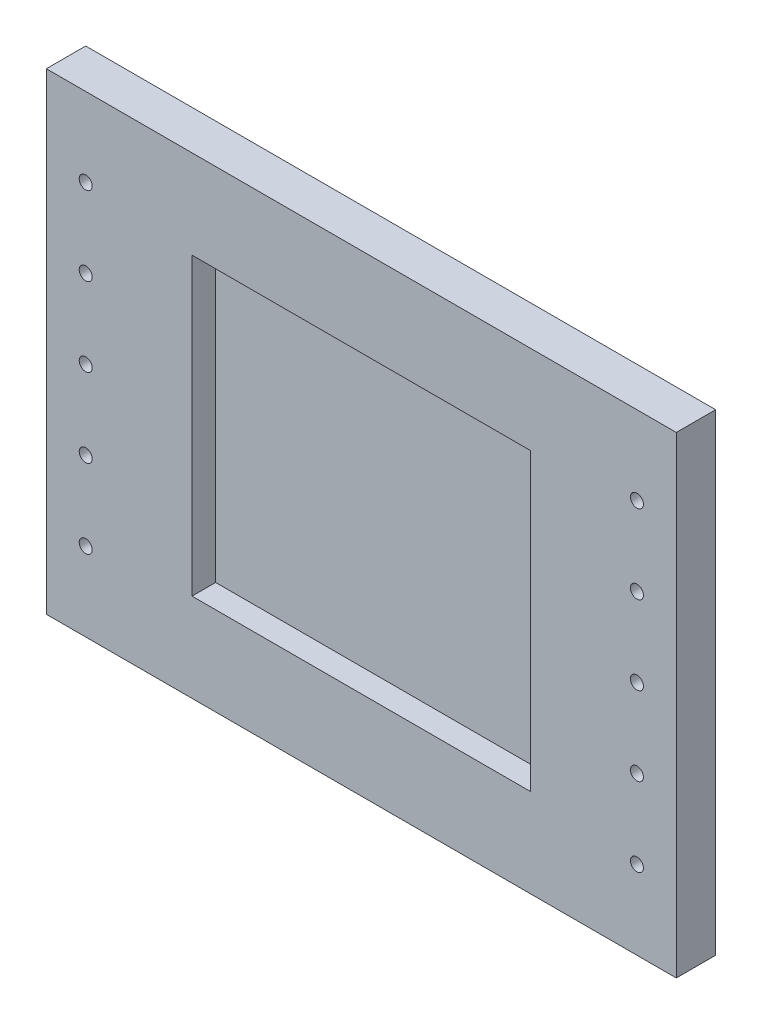
from build123d import *

# Parameters (mm, degrees)
SKETCH_1_W          = 160
SKETCH_1_H          = 120
EXTRUDE_1_DEPTH     = 10
SKETCH_2_W          = 86
SKETCH_2_H          = 75
CUT_EXTRUDE_1_DEPTH = 6
SKETCH_3_R          = 1.65
CUT_EXTRUDE_2_DEPTH = 101.498756211


with BuildPart() as part:
    # 草图1 → 凸台-拉伸1 (new body)
    with BuildSketch(Plane.XY):
        Rectangle(SKETCH_1_W, SKETCH_1_H)
    extrude(amount=EXTRUDE_1_DEPTH)

    # 草图2 → 切除-拉伸1 (cut)
    with BuildSketch(Plane.XY.offset(10)):
        Rectangle(SKETCH_2_W, SKETCH_2_H)
    extrude(amount=-CUT_EXTRUDE_1_DEPTH, mode=Mode.SUBTRACT)

    # 草图3 → 切除-拉伸2 (cut, through all)
    with BuildSketch(Plane(origin=(0, 0, 0), x_dir=(-1, 0, 0), z_dir=(0, 0, -1))):
        with Locations((-70, 40)):
            Circle(SKETCH_3_R)
        with Locations((-70, 20)):
            Circle(SKETCH_3_R)
        with Locations((-70, 0)):
            Circle(SKETCH_3_R)
        with Locations((-70, -20)):
            Circle(SKETCH_3_R)
        with Locations((-70, -40)):
            Circle(SKETCH_3_R)
    cut_extrude_2 = extrude(amount=-CUT_EXTRUDE_2_DEPTH, mode=Mode.SUBTRACT)

    # 镜向1: 切除-拉伸2 across plane
    add(cut_extrude_2.mirror(Plane(origin=(0, 0, 0), x_dir=(0, 0, 1), z_dir=(1, 0, 0))), mode=Mode.SUBTRACT)


solid = part.part
